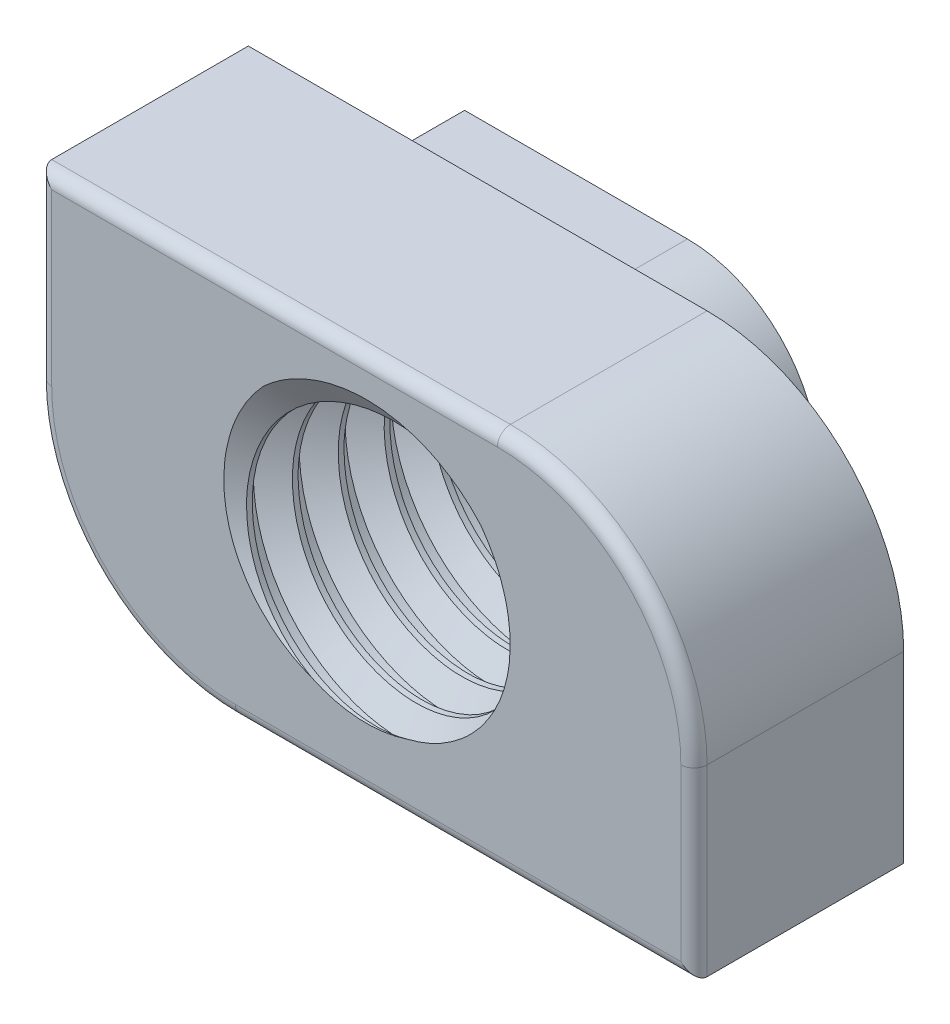
from build123d import *

# Parameters (mm, degrees)
CROQUIS1_W                               = 10
CROQUIS1_H                               = 5.8
SALIENTE_EXTRUIR1_DEPTH                  = 3.2
CROQUIS3_W                               = 5.4
CROQUIS3_H                               = 5.4
SALIENTE_EXTRUIR2_DEPTH                  = 1
REDONDEO2_R                              = 2
REDONDEO3_R                              = 3
REDONDEO4_R                              = 0.2
TALADRO_DE_MARGEN_PARA_M3_51_D           = 3.9
TALADRO_DE_MARGEN_PARA_M3_51_CSINK_D     = 3.95
TALADRO_DE_MARGEN_PARA_M3_51_CSINK_ANGLE = 90
ROSCA2_PITCH                             = 0.7


with BuildPart() as part:
    # Croquis1 → Saliente-Extruir1 (new body)
    with BuildSketch(Plane.XY):
        Rectangle(CROQUIS1_W, CROQUIS1_H)
    extrude(amount=SALIENTE_EXTRUIR1_DEPTH)

    # Croquis3 → Saliente-Extruir2 (add)
    with BuildSketch(Plane(origin=(0, 0, 0), x_dir=(-1, 0, 0), z_dir=(0, 0, -1))):
        Rectangle(CROQUIS3_W, CROQUIS3_H)
    extrude(amount=SALIENTE_EXTRUIR2_DEPTH)

    # Redondeo2
    redondeo2_edges = [part.edges().sort_by_distance(p)[0] for p in [
        (2.7, 2.7, -0.5),
        (-2.7, -2.7, -0.5),
    ]]
    fillet(redondeo2_edges, radius=REDONDEO2_R)

    # Redondeo3
    redondeo3_edges = [part.edges().sort_by_distance(p)[0] for p in [
        (-5, -2.9, 1.6),
        (5, 2.9, 1.6),
    ]]
    fillet(redondeo3_edges, radius=REDONDEO3_R)

    # Redondeo4
    redondeo4_edges = [part.edges().sort_by_distance(p)[0] for p in [
        (-1.5, 2.9, 3.2),
        (-5, 1.5, 3.2),
        (5, -1.5, 3.2),
        (1.5, -2.9, 3.2),
        (-4.121320344, -2.021320344, 3.2),
        (4.121320344, 2.021320344, 3.2),
    ]]
    fillet(redondeo4_edges, radius=REDONDEO4_R)

    # Taladro de margen para M3.51 (through all)
    with Locations(Plane(origin=(0, 0, -1), x_dir=(-1, 0, 0), z_dir=(0, 0, -1))):
        with Locations((0, 0)):
            CounterSinkHole(TALADRO_DE_MARGEN_PARA_M3_51_D / 2, TALADRO_DE_MARGEN_PARA_M3_51_CSINK_D / 2, counter_sink_angle=TALADRO_DE_MARGEN_PARA_M3_51_CSINK_ANGLE)

    # Rosca2: the profile of Perfil de rosca4 profile screwed along a right-hand helix of 14.285714 turns, 6 arcs to a turn; built about Z, then put on its axis
    rosca2_z = Axis((0, 0, 0), (0, 0, 1))
    rosca2_corners = [(1.9497, 0, -0.000173205), (1.9497, 0, 0.612673203), (2.328886112, 0, 0.393749999), (2.328886112, 0, 0.218749999)]
    with BuildLine(mode=Mode.PRIVATE) as rosca2_profile:
        Line(rosca2_corners[0], rosca2_corners[1])
        Line(rosca2_corners[1], rosca2_corners[2])
        Line(rosca2_corners[2], rosca2_corners[3])
        Line(rosca2_corners[3], rosca2_corners[0])
    rosca2_cap = Face(rosca2_profile.wire())
    rosca2_turn_angles = [0, 30, 60, 90, 120, 150, 180, 210, 240, 270, 300, 330, 360]
    rosca2_turn_weights = [1, 0.8660254037844387, 1, 0.8660254037844387, 1, 0.8660254037844387, 1, 0.8660254037844387, 1, 0.8660254037844387, 1, 0.8660254037844387, 1]
    rosca2_turn_rails = [Edge.make_bspline([Vector(p[0], p[1], 0).rotate(rosca2_z, rosca2_turn_angles[k]) / rosca2_turn_weights[k] + Vector(0, 0, p[2] + ROSCA2_PITCH * rosca2_turn_angles[k] / 360) for k in range(13)], [0, 0, 0, 1, 1, 2, 2, 3, 3, 4, 4, 5, 5, 6, 6, 6], 2, rosca2_turn_weights) for p in rosca2_corners]
    rosca2_turn_sides = [Face.make_surface_from_curves(rosca2_turn_rails[p[0]], rosca2_turn_rails[p[1]]) for p in [(0, 1), (1, 2), (2, 3), (3, 0)]]
    rosca2_last_angles = [5040, 5070, 5100, 5121.428571429, 5142.857142857]
    rosca2_last_weights = [1, 0.8660254037844387, 1, 0.9308737486442035, 1]
    rosca2_last_rails = [Edge.make_bspline([Vector(p[0], p[1], 0).rotate(rosca2_z, rosca2_last_angles[k]) / rosca2_last_weights[k] + Vector(0, 0, p[2] + ROSCA2_PITCH * rosca2_last_angles[k] / 360) for k in range(5)], [0, 0, 0, 1, 1, 2, 2, 2], 2, rosca2_last_weights) for p in rosca2_corners]
    rosca2_last_sides = [Face.make_surface_from_curves(rosca2_last_rails[p[0]], rosca2_last_rails[p[1]]) for p in [(0, 1), (1, 2), (2, 3), (3, 0)]]
    rosca2 = Plane(origin=(0, 0, -1.475), x_dir=(1, 0, 0), z_dir=(0, 0, 1)) * Solid(Shell([*[p.moved(Location((0, 0, ROSCA2_PITCH * i))) for i in range(14) for p in rosca2_turn_sides], *rosca2_last_sides, rosca2_cap, rosca2_cap.rotate(rosca2_z, 5142.857142857).moved(Location((0, 0, ROSCA2_PITCH * 5142.857142857 / 360)))]))
    add(rosca2, mode=Mode.SUBTRACT)


solid = part.part
